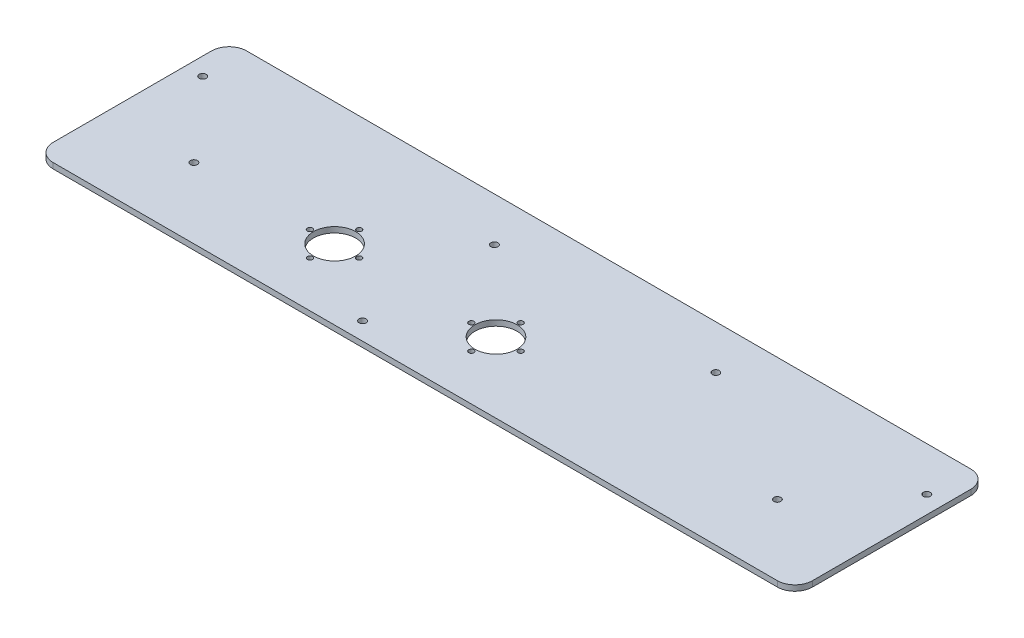
from build123d import *

# Parameters (mm, degrees)
SKETCH1_W           = 431.8
SKETCH1_H           = 110
SKETCH1_R           = 2
SKETCH1_R_2         = 1.5
SKETCH1_R_3         = 12
BOSS_EXTRUDE1_DEPTH = 3.175
FILLET1_R           = 10


with BuildPart() as part:
    # Sketch1 → Boss-Extrude1 (new body)
    with BuildSketch(Plane(origin=(0, 0, 0), x_dir=(1, 0, 0), z_dir=(0, 1, 0))):
        with Locations((189.100422465, 55)):
            Rectangle(SKETCH1_W, SKETCH1_H)
        with Locations((23.200422465, 40)):
            Circle(SKETCH1_R, mode=Mode.SUBTRACT)
        with Locations((89.200422465, 40)):
            Circle(SKETCH1_R_2, mode=Mode.SUBTRACT)
        with Locations((103.200422465, 26)):
            Circle(SKETCH1_R_2, mode=Mode.SUBTRACT)
        with Locations((117.200422465, 40)):
            Circle(SKETCH1_R_2, mode=Mode.SUBTRACT)
        with Locations((181.000422465, 40)):
            Circle(SKETCH1_R_2, mode=Mode.SUBTRACT)
        with Locations((195.000422465, 26)):
            Circle(SKETCH1_R_2, mode=Mode.SUBTRACT)
        with Locations((209.000422465, 40)):
            Circle(SKETCH1_R_2, mode=Mode.SUBTRACT)
        with Locations((355.000422465, 40)):
            Circle(SKETCH1_R, mode=Mode.SUBTRACT)
        with Locations((149.100422465, 10)):
            Circle(SKETCH1_R, mode=Mode.SUBTRACT)
        with Locations((-16.799577535, 85)):
            Circle(SKETCH1_R, mode=Mode.SUBTRACT)
        with Locations((149.100422465, 85)):
            Circle(SKETCH1_R, mode=Mode.SUBTRACT)
        with Locations((103.200422465, 54)):
            Circle(SKETCH1_R_2, mode=Mode.SUBTRACT)
        with Locations((103.200422465, 40)):
            Circle(SKETCH1_R_3, mode=Mode.SUBTRACT)
        with Locations((275.000422465, 85)):
            Circle(SKETCH1_R, mode=Mode.SUBTRACT)
        with Locations((195.000422465, 54)):
            Circle(SKETCH1_R_2, mode=Mode.SUBTRACT)
        with Locations((195.000422465, 40)):
            Circle(SKETCH1_R_3, mode=Mode.SUBTRACT)
        with Locations((395.000422465, 85)):
            Circle(SKETCH1_R, mode=Mode.SUBTRACT)
    extrude(amount=BOSS_EXTRUDE1_DEPTH)

    # Fillet1
    fillet1_edges = [part.edges().sort_by_distance(p)[0] for p in [
        (405.000422465, 1.5875, -110),
        (405.000422465, 1.5875, 0),
        (-26.799577535, 1.5875, 0),
        (-26.799577535, 1.5875, -110),
    ]]
    fillet(fillet1_edges, radius=FILLET1_R)


solid = part.part
